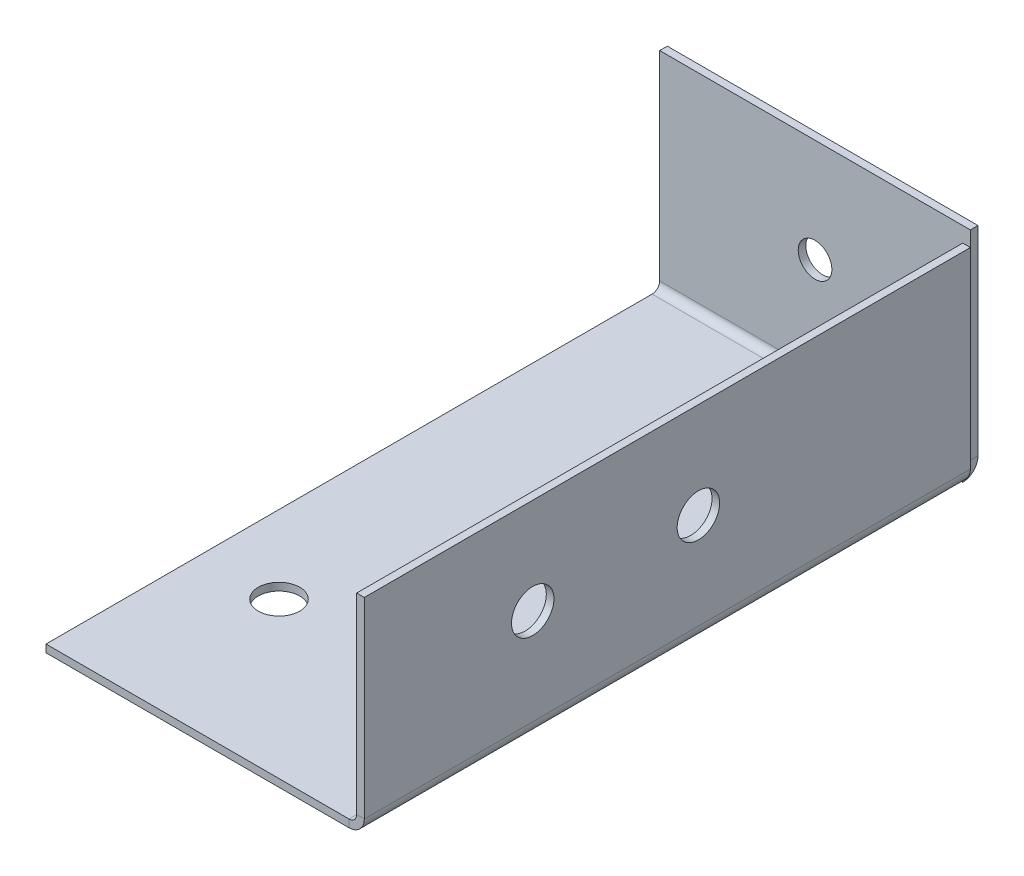
from build123d import *

# Parameters (mm, degrees)
SKETCH1_W                    = 30
SKETCH1_H                    = 60
SKETCH1_R                    = 2
BASE_FLANGE1_DEPTH           = 0.7366
EDGE_FLANGE1_STRIP_W         = 4.4196
EDGE_FLANGE1_STRIP_H         = 0.7366
EDGE_FLANGE1_STRIP_CUT_DEPTH = 30
EDGE_FLANGE1_DEPTH           = 30
EDGE_FLANGE1_PROFILE_W       = 30
EDGE_FLANGE1_PROFILE_H       = 19.2634
EDGE_FLANGE1_PROFILE_R       = 1.625
EDGE_FLANGE1_FLAT_DEPTH      = 0.7366
EDGE_FLANGE6_STRIP_W         = 4.4196
EDGE_FLANGE6_STRIP_H         = 0.7366
EDGE_FLANGE6_STRIP_CUT_DEPTH = 58.5268
EDGE_FLANGE6_DEPTH           = 58.5268
SKETCH24_R                   = 2.05
CUT_EXTRUDE1_DEPTH           = 409.183232337


# Sheet-metal steps are written as plain solids
with BuildPart() as part:
    # Sketch1 → Base-Flange1 (new body)
    with BuildSketch(Plane(origin=(0, 0, 0), x_dir=(1, 0, 0), z_dir=(0, 1, 0))):
        Rectangle(SKETCH1_W, SKETCH1_H)
        with Locations(Location((7.5, -15, 0), (0, 0, 270))):
            Circle(SKETCH1_R, mode=Mode.SUBTRACT)
        with Locations(Location((0, 15, 0), (0, 0, 270))):
            Circle(SKETCH1_R, mode=Mode.SUBTRACT)
        with Locations(Location((-7.5, -15, 0), (0, 0, 270))):
            Circle(SKETCH1_R, mode=Mode.SUBTRACT)
    extrude(amount=-BASE_FLANGE1_DEPTH)

    # Edge-Flange1 strip (across the edge) → Edge-Flange1 strip cut (cut)
    with BuildSketch(Plane(origin=(15, 0, -30), x_dir=(0, 0, 1), z_dir=(-1, 0, 0))):
        with Locations((-0.7366, -0.3683)):
            Rectangle(EDGE_FLANGE1_STRIP_W, EDGE_FLANGE1_STRIP_H)
    extrude(amount=EDGE_FLANGE1_STRIP_CUT_DEPTH, mode=Mode.SUBTRACT)

    # Edge-Flange1 bend section (across the edge) → Edge-Flange1 (add)
    with BuildSketch(Plane(origin=(15, 0, -30), x_dir=(0, 0, 1), z_dir=(-1, 0, 0))):
        with BuildLine():
            Line((0, 0.7366), (0.7366, 0.7366))
            ThreePointArc((0.7366, 0.7366), (0.952345145, 0.215745145), (1.4732, 0))
            Line((1.4732, 0), (1.4732, -0.7366))
            ThreePointArc((1.4732, -0.7366), (0.43149029, -0.30510971), (0, 0.7366))
        make_face()
    extrude(amount=EDGE_FLANGE1_DEPTH)

    # Edge-Flange1 profile (on flange) → Edge-Flange1 flat (add)
    with BuildSketch(Plane(origin=(0, 0, -30), x_dir=(-1, 0, 0), z_dir=(0, 0, -1))):
        with Locations((0, 10.3683)):
            Rectangle(EDGE_FLANGE1_PROFILE_W, EDGE_FLANGE1_PROFILE_H)
        with Locations((0, 10)):
            Circle(EDGE_FLANGE1_PROFILE_R, mode=Mode.SUBTRACT)
    extrude(amount=-EDGE_FLANGE1_FLAT_DEPTH)

    # Edge-Flange6 strip (across the edge) → Edge-Flange6 strip cut (cut)
    with BuildSketch(Plane(origin=(15, 0, 30), x_dir=(-1, 0, 0), z_dir=(0, 0, -1))):
        with Locations((-1.4732, -0.3683)):
            Rectangle(EDGE_FLANGE6_STRIP_W, EDGE_FLANGE6_STRIP_H)
    extrude(amount=EDGE_FLANGE6_STRIP_CUT_DEPTH, mode=Mode.SUBTRACT)

    # Edge-Flange6 section (across the edge) → Edge-Flange6 (add)
    with BuildSketch(Plane(origin=(15, 0, 30), x_dir=(-1, 0, 0), z_dir=(0, 0, -1))):
        with BuildLine():
            Line((-0.7366, 0.7366), (-0.7366, 19.2634))
            Line((-0.7366, 19.2634), (0, 19.2634))
            Line((0, 19.2634), (0, 0.7366))
            ThreePointArc((0, 0.7366), (0.215745145, 0.215745145), (0.7366, 0))
            Line((0.7366, 0), (0.7366, -0.7366))
            ThreePointArc((0.7366, -0.7366), (-0.30510971, -0.30510971), (-0.7366, 0.7366))
        make_face()
    extrude(amount=EDGE_FLANGE6_DEPTH)

    # Sketch24 → Cut-Extrude1 (cut, through all)
    with BuildSketch(Plane(origin=(385, -11.740421973, -44.873872437), x_dir=(0, 0, -1), z_dir=(1, 0, 0))):
        with Locations((-42.610472437, 21.740421973)):
            Circle(SKETCH24_R)
        with Locations((-58.610472437, 21.740421973)):
            Circle(SKETCH24_R)
    extrude(amount=-CUT_EXTRUDE1_DEPTH, mode=Mode.SUBTRACT)


solid = part.part
